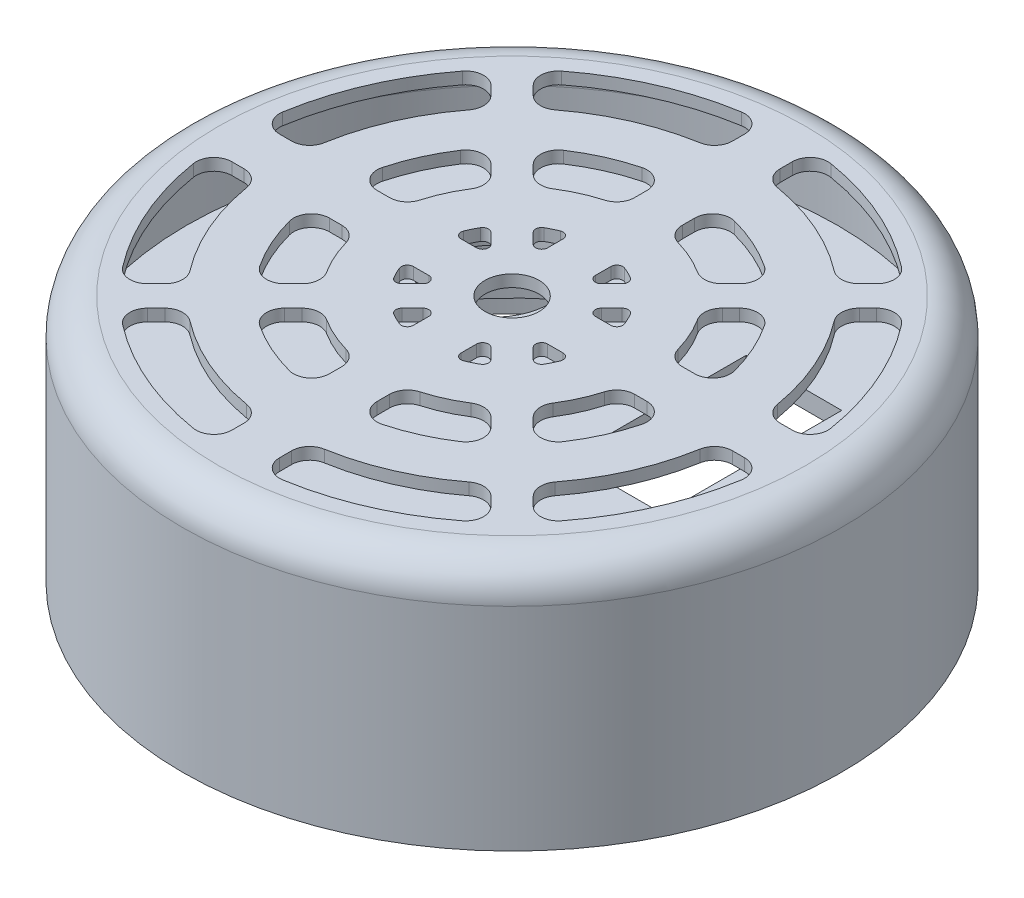
from build123d import *

# Parameters (mm, degrees)
SKETCH1_R                 = 55.2
BOSS_EXTRUDE1_DEPTH       = 3
SKETCH2_R                 = 55
CUT_EXTRUDE1_DEPTH        = 79.12221195
SKETCH4_R                 = 55.2
BOSS_EXTRUDE2_DEPTH       = 18.5
BOSS_EXTRUDE4_DEPTH       = 3
SKETCH6_R                 = 55.2
SKETCH6_R_2               = 9.5
SKETCH6_W                 = 16
SKETCH6_H                 = 30
BOSS_EXTRUDE3_DEPTH       = 3
SKETCH9_R                 = 55.2
SKETCH9_R_2               = 54.5
BOSS_EXTRUDE5_DEPTH       = 15
SKETCH10_R                = 55.2
SKETCH10_R_2              = 4.531369834
BOSS_EXTRUDE6_DEPTH       = 2
BOSS_EXTRUDE9_REACH       = 89.042
SKETCH15_R                = 3
F_3_0MM_DOWEL_HOLE2_D     = 3
F_3_0MM_DOWEL_HOLE2_DEPTH = 14
F_3_0MM_DOWEL_HOLE2_TIP   = 0.901290929
FILLET3_R                 = 6


with BuildPart() as part:
    # Sketch1 → Boss-Extrude1 (new body)
    with BuildSketch(Plane(origin=(0, 0, 0), x_dir=(1, 0, 0), z_dir=(0, 1, 0))):
        Circle(SKETCH1_R)
    extrude(amount=BOSS_EXTRUDE1_DEPTH)

    # Sketch2 → Cut-Extrude1 (cut, through all)
    with BuildSketch(Plane(origin=(0, 3, 0), x_dir=(1, 0, 0), z_dir=(0, 1, 0))):
        Circle(SKETCH2_R)
    extrude(amount=-CUT_EXTRUDE1_DEPTH, mode=Mode.SUBTRACT)

    # Sketch4 → Boss-Extrude2 (add)
    with BuildSketch(Plane(origin=(0, 3, 0), x_dir=(1, 0, 0), z_dir=(0, 1, 0))):
        Circle(SKETCH4_R)
        with BuildLine():
            Line((-45.2, -5), (-45.2, 5))
            Line((-45.2, 5), (-53.768020235, 5))
            ThreePointArc((-53.768020235, 5), (54, 0), (-53.768020235, -5))
            Line((-53.768020235, -5), (-45.2, -5))
        make_face(mode=Mode.SUBTRACT)
    extrude(amount=BOSS_EXTRUDE2_DEPTH)

    # Sketch8 → Boss-Extrude4 (add)
    with BuildSketch(Plane.XZ.offset(-3)):
        with BuildLine():
            Line((-45.2, 5), (-54.772255751, 5))
            ThreePointArc((-54.772255751, 5), (-55, 0), (-54.772255751, -5))
            Line((-54.772255751, -5), (-45.2, -5))
            Line((-45.2, -5), (-45.2, 5))
        make_face()
    extrude(amount=BOSS_EXTRUDE4_DEPTH)

    # Sketch6 → Boss-Extrude3 (add)
    with BuildSketch(Plane(origin=(0, 21.5, 0), x_dir=(1, 0, 0), z_dir=(0, 1, 0))):
        Circle(SKETCH6_R)
        with Locations((-22.20107336, 19.059873591)):
            Circle(SKETCH6_R_2, mode=Mode.SUBTRACT)
        with Locations((19.213108786, 13)):
            Rectangle(SKETCH6_W, SKETCH6_H, mode=Mode.SUBTRACT)
    extrude(amount=BOSS_EXTRUDE3_DEPTH)

    # Sketch9 → Boss-Extrude5 (add)
    with BuildSketch(Plane(origin=(0, 24.5, 0), x_dir=(1, 0, 0), z_dir=(0, 1, 0))):
        Circle(SKETCH9_R)
        Circle(SKETCH9_R_2, mode=Mode.SUBTRACT)
    extrude(amount=BOSS_EXTRUDE5_DEPTH)

    # Sketch10 → Boss-Extrude6 (add)
    with BuildSketch(Plane(origin=(0, 39.5, 0), x_dir=(1, 0, 0), z_dir=(0, 1, 0))):
        Circle(SKETCH10_R)
        Circle(SKETCH10_R_2, mode=Mode.SUBTRACT)
        with BuildLine():
            Line((-4, 40.905378619), (-4, 42.933087473))
            ThreePointArc((-4, 42.933087473), (-5.056842243, 45.218724787), (-7.482758621, 45.893990058))
            ThreePointArc((-7.482758621, 45.893990058), (-18.54054336, 42.643853624), (-28.459288433, 36.77388886))
            ThreePointArc((-28.459288433, 36.77388886), (-29.617180258, 34.591416734), (-28.744525652, 32.280059558))
            Line((-28.744525652, 32.280059558), (-27.318312192, 30.853846097))
            ThreePointArc((-27.318312192, 30.853846097), (-25.396226878, 29.981789518), (-23.375522558, 30.591419469))
            ThreePointArc((-23.375522558, 30.591419469), (-15.38108872, 35.294080379), (-6.493975904, 37.948363298))
            ThreePointArc((-6.493975904, 37.948363298), (-4.706741152, 38.971221476), (-4, 40.905378619))
        make_face(mode=Mode.SUBTRACT)
        with BuildLine():
            Line((-4, 24.52039967), (-4, 26.594172294))
            ThreePointArc((-4, 26.594172294), (-5.168458176, 28.970188823), (-7.763636364, 29.495354726))
            ThreePointArc((-7.763636364, 29.495354726), (-12.456434236, 27.840388756), (-16.817668487, 25.444371218))
            ThreePointArc((-16.817668487, 25.444371218), (-18.148280046, 23.243173066), (-17.28479193, 20.820325836))
            Line((-17.28479193, 20.820325836), (-15.839049909, 19.374583815))
            ThreePointArc((-15.839049909, 19.374583815), (-14.043179698, 18.513609369), (-12.103879028, 18.966974257))
            ThreePointArc((-12.103879028, 18.966974257), (-9.237058448, 20.516499488), (-6.176470588, 21.635646768))
            ThreePointArc((-6.176470588, 21.635646768), (-4.60515259, 22.713549958), (-4, 24.52039967))
        make_face(mode=Mode.SUBTRACT)
        with BuildLine():
            Line((-4, 9.949747468), (-4, 12.539936204))
            ThreePointArc((-4, 12.539936204), (-4.438916392, 13.367695339), (-5.37037037, 13.468820367))
            ThreePointArc((-5.37037037, 13.468820367), (-6.323646825, 13.048428673), (-7.244275962, 12.560671391))
            ThreePointArc((-7.244275962, 12.560671391), (-7.736085814, 11.825170316), (-7.451777504, 10.98731141))
            Line((-7.451777504, 10.98731141), (-5.707106781, 9.242640687))
            ThreePointArc((-5.707106781, 9.242640687), (-4.617316568, 9.025867936), (-4, 9.949747468))
        make_face(mode=Mode.SUBTRACT)
        with BuildLine():
            Line((-12.539936204, 4), (-9.949747468, 4))
            ThreePointArc((-9.949747468, 4), (-9.025867936, 4.617316568), (-9.242640687, 5.707106781))
            Line((-9.242640687, 5.707106781), (-10.98731141, 7.451777504))
            ThreePointArc((-10.98731141, 7.451777504), (-11.825170316, 7.736085814), (-12.560671391, 7.244275962))
            ThreePointArc((-12.560671391, 7.244275962), (-13.048428673, 6.323646825), (-13.468820367, 5.37037037))
            ThreePointArc((-13.468820367, 5.37037037), (-13.367695339, 4.438916392), (-12.539936204, 4))
        make_face(mode=Mode.SUBTRACT)
        with BuildLine():
            Line((-26.594172294, 4), (-24.52039967, 4))
            ThreePointArc((-24.52039967, 4), (-22.713549958, 4.60515259), (-21.635646768, 6.176470588))
            ThreePointArc((-21.635646768, 6.176470588), (-20.516499488, 9.237058448), (-18.966974257, 12.103879028))
            ThreePointArc((-18.966974257, 12.103879028), (-18.513609369, 14.043179698), (-19.374583815, 15.839049909))
            Line((-19.374583815, 15.839049909), (-20.820325836, 17.28479193))
            ThreePointArc((-20.820325836, 17.28479193), (-23.243173066, 18.148280046), (-25.444371218, 16.817668487))
            ThreePointArc((-25.444371218, 16.817668487), (-27.840388756, 12.456434236), (-29.495354726, 7.763636364))
            ThreePointArc((-29.495354726, 7.763636364), (-28.970188823, 5.168458176), (-26.594172294, 4))
        make_face(mode=Mode.SUBTRACT)
        with BuildLine():
            Line((-42.933087473, 4), (-40.905378619, 4))
            ThreePointArc((-40.905378619, 4), (-38.971221476, 4.706741152), (-37.948363298, 6.493975904))
            ThreePointArc((-37.948363298, 6.493975904), (-35.294080379, 15.38108872), (-30.591419469, 23.375522558))
            ThreePointArc((-30.591419469, 23.375522558), (-29.981789518, 25.396226878), (-30.853846097, 27.318312192))
            Line((-30.853846097, 27.318312192), (-32.280059558, 28.744525652))
            ThreePointArc((-32.280059558, 28.744525652), (-34.591416734, 29.617180258), (-36.77388886, 28.459288433))
            ThreePointArc((-36.77388886, 28.459288433), (-42.643853624, 18.54054336), (-45.893990058, 7.482758621))
            ThreePointArc((-45.893990058, 7.482758621), (-45.218724787, 5.056842243), (-42.933087473, 4))
        make_face(mode=Mode.SUBTRACT)
        with BuildLine():
            Line((9.242640687, 5.707106781), (10.98731141, 7.451777504))
            ThreePointArc((10.98731141, 7.451777504), (11.825170316, 7.736085814), (12.560671391, 7.244275962))
            ThreePointArc((12.560671391, 7.244275962), (13.048428673, 6.323646825), (13.468820367, 5.37037037))
            ThreePointArc((13.468820367, 5.37037037), (13.367695339, 4.438916392), (12.539936204, 4))
            Line((12.539936204, 4), (9.949747468, 4))
            ThreePointArc((9.949747468, 4), (9.025867936, 4.617316568), (9.242640687, 5.707106781))
        make_face(mode=Mode.SUBTRACT)
        with BuildLine():
            Line((5.707106781, 9.242640687), (7.451777504, 10.98731141))
            ThreePointArc((7.451777504, 10.98731141), (7.736085814, 11.825170316), (7.244275962, 12.560671391))
            ThreePointArc((7.244275962, 12.560671391), (6.323646825, 13.048428673), (5.37037037, 13.468820367))
            ThreePointArc((5.37037037, 13.468820367), (4.438916392, 13.367695339), (4, 12.539936204))
            Line((4, 12.539936204), (4, 9.949747468))
            ThreePointArc((4, 9.949747468), (4.617316568, 9.025867936), (5.707106781, 9.242640687))
        make_face(mode=Mode.SUBTRACT)
        with BuildLine():
            Line((4, 24.52039967), (4, 26.594172294))
            ThreePointArc((4, 26.594172294), (5.168458176, 28.970188823), (7.763636364, 29.495354726))
            ThreePointArc((7.763636364, 29.495354726), (12.456434236, 27.840388756), (16.817668487, 25.444371218))
            ThreePointArc((16.817668487, 25.444371218), (18.148280046, 23.243173066), (17.28479193, 20.820325836))
            Line((17.28479193, 20.820325836), (15.839049909, 19.374583815))
            ThreePointArc((15.839049909, 19.374583815), (14.043179698, 18.513609369), (12.103879028, 18.966974257))
            ThreePointArc((12.103879028, 18.966974257), (9.237058448, 20.516499488), (6.176470588, 21.635646768))
            ThreePointArc((6.176470588, 21.635646768), (4.60515259, 22.713549958), (4, 24.52039967))
        make_face(mode=Mode.SUBTRACT)
        with BuildLine():
            Line((19.374583815, 15.839049909), (20.820325836, 17.28479193))
            ThreePointArc((20.820325836, 17.28479193), (23.243173066, 18.148280046), (25.444371218, 16.817668487))
            ThreePointArc((25.444371218, 16.817668487), (27.840388756, 12.456434236), (29.495354726, 7.763636364))
            ThreePointArc((29.495354726, 7.763636364), (28.970188823, 5.168458176), (26.594172294, 4))
            Line((26.594172294, 4), (24.52039967, 4))
            ThreePointArc((24.52039967, 4), (22.713549958, 4.60515259), (21.635646768, 6.176470588))
            ThreePointArc((21.635646768, 6.176470588), (20.516499488, 9.237058448), (18.966974257, 12.103879028))
            ThreePointArc((18.966974257, 12.103879028), (18.513609369, 14.043179698), (19.374583815, 15.839049909))
        make_face(mode=Mode.SUBTRACT)
        with BuildLine():
            Line((42.933087473, 4), (40.905378619, 4))
            ThreePointArc((40.905378619, 4), (38.971221476, 4.706741152), (37.948363298, 6.493975904))
            ThreePointArc((37.948363298, 6.493975904), (35.294080379, 15.38108872), (30.591419469, 23.375522558))
            ThreePointArc((30.591419469, 23.375522558), (29.981789518, 25.396226878), (30.853846097, 27.318312192))
            Line((30.853846097, 27.318312192), (32.280059558, 28.744525652))
            ThreePointArc((32.280059558, 28.744525652), (34.591416734, 29.617180258), (36.77388886, 28.459288433))
            ThreePointArc((36.77388886, 28.459288433), (42.643853624, 18.54054336), (45.893990058, 7.482758621))
            ThreePointArc((45.893990058, 7.482758621), (45.218724787, 5.056842243), (42.933087473, 4))
        make_face(mode=Mode.SUBTRACT)
        with BuildLine():
            Line((4, 40.905378619), (4, 42.933087473))
            ThreePointArc((4, 42.933087473), (5.056842243, 45.218724787), (7.482758621, 45.893990058))
            ThreePointArc((7.482758621, 45.893990058), (18.54054336, 42.643853624), (28.459288433, 36.77388886))
            ThreePointArc((28.459288433, 36.77388886), (29.617180258, 34.591416734), (28.744525652, 32.280059558))
            Line((28.744525652, 32.280059558), (27.318312192, 30.853846097))
            ThreePointArc((27.318312192, 30.853846097), (25.396226878, 29.981789518), (23.375522558, 30.591419469))
            ThreePointArc((23.375522558, 30.591419469), (15.38108872, 35.294080379), (6.493975904, 37.948363298))
            ThreePointArc((6.493975904, 37.948363298), (4.706741152, 38.971221476), (4, 40.905378619))
        make_face(mode=Mode.SUBTRACT)
        with BuildLine():
            Line((30.853846097, -27.318312192), (32.280059558, -28.744525652))
            ThreePointArc((32.280059558, -28.744525652), (34.591416734, -29.617180258), (36.77388886, -28.459288433))
            ThreePointArc((36.77388886, -28.459288433), (42.643853624, -18.54054336), (45.893990058, -7.482758621))
            ThreePointArc((45.893990058, -7.482758621), (45.218724787, -5.056842243), (42.933087473, -4))
            Line((42.933087473, -4), (40.905378619, -4))
            ThreePointArc((40.905378619, -4), (38.971221476, -4.706741152), (37.948363298, -6.493975904))
            ThreePointArc((37.948363298, -6.493975904), (35.294080379, -15.38108872), (30.591419469, -23.375522558))
            ThreePointArc((30.591419469, -23.375522558), (29.981789518, -25.396226878), (30.853846097, -27.318312192))
        make_face(mode=Mode.SUBTRACT)
        with BuildLine():
            Line((26.594172294, -4), (24.52039967, -4))
            ThreePointArc((24.52039967, -4), (22.713549958, -4.60515259), (21.635646768, -6.176470588))
            ThreePointArc((21.635646768, -6.176470588), (20.516499488, -9.237058448), (18.966974257, -12.103879028))
            ThreePointArc((18.966974257, -12.103879028), (18.513609369, -14.043179698), (19.374583815, -15.839049909))
            Line((19.374583815, -15.839049909), (20.820325836, -17.28479193))
            ThreePointArc((20.820325836, -17.28479193), (23.243173066, -18.148280046), (25.444371218, -16.817668487))
            ThreePointArc((25.444371218, -16.817668487), (27.840388756, -12.456434236), (29.495354726, -7.763636364))
            ThreePointArc((29.495354726, -7.763636364), (28.970188823, -5.168458176), (26.594172294, -4))
        make_face(mode=Mode.SUBTRACT)
        with BuildLine():
            Line((9.242640687, -5.707106781), (10.98731141, -7.451777504))
            ThreePointArc((10.98731141, -7.451777504), (11.825170316, -7.736085814), (12.560671391, -7.244275962))
            ThreePointArc((12.560671391, -7.244275962), (13.048428673, -6.323646825), (13.468820367, -5.37037037))
            ThreePointArc((13.468820367, -5.37037037), (13.367695339, -4.438916392), (12.539936204, -4))
            Line((12.539936204, -4), (9.949747468, -4))
            ThreePointArc((9.949747468, -4), (9.025867936, -4.617316568), (9.242640687, -5.707106781))
        make_face(mode=Mode.SUBTRACT)
        with BuildLine():
            Line((-9.242640687, -5.707106781), (-10.98731141, -7.451777504))
            ThreePointArc((-10.98731141, -7.451777504), (-11.825170316, -7.736085814), (-12.560671391, -7.244275962))
            ThreePointArc((-12.560671391, -7.244275962), (-13.048428673, -6.323646825), (-13.468820367, -5.37037037))
            ThreePointArc((-13.468820367, -5.37037037), (-13.367695339, -4.438916392), (-12.539936204, -4))
            Line((-12.539936204, -4), (-9.949747468, -4))
            ThreePointArc((-9.949747468, -4), (-9.025867936, -4.617316568), (-9.242640687, -5.707106781))
        make_face(mode=Mode.SUBTRACT)
        with BuildLine():
            Line((-5.707106781, -9.242640687), (-7.451777504, -10.98731141))
            ThreePointArc((-7.451777504, -10.98731141), (-7.736085814, -11.825170316), (-7.244275962, -12.560671391))
            ThreePointArc((-7.244275962, -12.560671391), (-6.323646825, -13.048428673), (-5.37037037, -13.468820367))
            ThreePointArc((-5.37037037, -13.468820367), (-4.438916392, -13.367695339), (-4, -12.539936204))
            Line((-4, -12.539936204), (-4, -9.949747468))
            ThreePointArc((-4, -9.949747468), (-4.617316568, -9.025867936), (-5.707106781, -9.242640687))
        make_face(mode=Mode.SUBTRACT)
        with BuildLine():
            Line((4, -9.949747468), (4, -12.539936204))
            ThreePointArc((4, -12.539936204), (4.438916392, -13.367695339), (5.37037037, -13.468820367))
            ThreePointArc((5.37037037, -13.468820367), (6.323646825, -13.048428673), (7.244275962, -12.560671391))
            ThreePointArc((7.244275962, -12.560671391), (7.736085814, -11.825170316), (7.451777504, -10.98731141))
            Line((7.451777504, -10.98731141), (5.707106781, -9.242640687))
            ThreePointArc((5.707106781, -9.242640687), (4.617316568, -9.025867936), (4, -9.949747468))
        make_face(mode=Mode.SUBTRACT)
        with BuildLine():
            Line((4, -24.52039967), (4, -26.594172294))
            ThreePointArc((4, -26.594172294), (5.168458176, -28.970188823), (7.763636364, -29.495354726))
            ThreePointArc((7.763636364, -29.495354726), (12.456434236, -27.840388756), (16.817668487, -25.444371218))
            ThreePointArc((16.817668487, -25.444371218), (18.148280046, -23.243173066), (17.28479193, -20.820325836))
            Line((17.28479193, -20.820325836), (15.839049909, -19.374583815))
            ThreePointArc((15.839049909, -19.374583815), (14.043179698, -18.513609369), (12.103879028, -18.966974257))
            ThreePointArc((12.103879028, -18.966974257), (9.237058448, -20.516499488), (6.176470588, -21.635646768))
            ThreePointArc((6.176470588, -21.635646768), (4.60515259, -22.713549958), (4, -24.52039967))
        make_face(mode=Mode.SUBTRACT)
        with BuildLine():
            Line((4, -40.905378619), (4, -42.933087473))
            ThreePointArc((4, -42.933087473), (5.056842243, -45.218724787), (7.482758621, -45.893990058))
            ThreePointArc((7.482758621, -45.893990058), (18.54054336, -42.643853624), (28.459288433, -36.77388886))
            ThreePointArc((28.459288433, -36.77388886), (29.617180258, -34.591416734), (28.744525652, -32.280059558))
            Line((28.744525652, -32.280059558), (27.318312192, -30.853846097))
            ThreePointArc((27.318312192, -30.853846097), (25.396226878, -29.981789518), (23.375522558, -30.591419469))
            ThreePointArc((23.375522558, -30.591419469), (15.38108872, -35.294080379), (6.493975904, -37.948363298))
            ThreePointArc((6.493975904, -37.948363298), (4.706741152, -38.971221476), (4, -40.905378619))
        make_face(mode=Mode.SUBTRACT)
        with BuildLine():
            Line((-4, -24.52039967), (-4, -26.594172294))
            ThreePointArc((-4, -26.594172294), (-5.168458176, -28.970188823), (-7.763636364, -29.495354726))
            ThreePointArc((-7.763636364, -29.495354726), (-12.456434236, -27.840388756), (-16.817668487, -25.444371218))
            ThreePointArc((-16.817668487, -25.444371218), (-18.148280046, -23.243173066), (-17.28479193, -20.820325836))
            Line((-17.28479193, -20.820325836), (-15.839049909, -19.374583815))
            ThreePointArc((-15.839049909, -19.374583815), (-14.043179698, -18.513609369), (-12.103879028, -18.966974257))
            ThreePointArc((-12.103879028, -18.966974257), (-9.237058448, -20.516499488), (-6.176470588, -21.635646768))
            ThreePointArc((-6.176470588, -21.635646768), (-4.60515259, -22.713549958), (-4, -24.52039967))
        make_face(mode=Mode.SUBTRACT)
        with BuildLine():
            Line((-19.374583815, -15.839049909), (-20.820325836, -17.28479193))
            ThreePointArc((-20.820325836, -17.28479193), (-23.243173066, -18.148280046), (-25.444371218, -16.817668487))
            ThreePointArc((-25.444371218, -16.817668487), (-27.840388756, -12.456434236), (-29.495354726, -7.763636364))
            ThreePointArc((-29.495354726, -7.763636364), (-28.970188823, -5.168458176), (-26.594172294, -4))
            Line((-26.594172294, -4), (-24.52039967, -4))
            ThreePointArc((-24.52039967, -4), (-22.713549958, -4.60515259), (-21.635646768, -6.176470588))
            ThreePointArc((-21.635646768, -6.176470588), (-20.516499488, -9.237058448), (-18.966974257, -12.103879028))
            ThreePointArc((-18.966974257, -12.103879028), (-18.513609369, -14.043179698), (-19.374583815, -15.839049909))
        make_face(mode=Mode.SUBTRACT)
        with BuildLine():
            Line((-42.933087473, -4), (-40.905378619, -4))
            ThreePointArc((-40.905378619, -4), (-38.971221476, -4.706741152), (-37.948363298, -6.493975904))
            ThreePointArc((-37.948363298, -6.493975904), (-35.294080379, -15.38108872), (-30.591419469, -23.375522558))
            ThreePointArc((-30.591419469, -23.375522558), (-29.981789518, -25.396226878), (-30.853846097, -27.318312192))
            Line((-30.853846097, -27.318312192), (-32.280059558, -28.744525652))
            ThreePointArc((-32.280059558, -28.744525652), (-34.591416734, -29.617180258), (-36.77388886, -28.459288433))
            ThreePointArc((-36.77388886, -28.459288433), (-42.643853624, -18.54054336), (-45.893990058, -7.482758621))
            ThreePointArc((-45.893990058, -7.482758621), (-45.218724787, -5.056842243), (-42.933087473, -4))
        make_face(mode=Mode.SUBTRACT)
        with BuildLine():
            Line((-4, -40.905378619), (-4, -42.933087473))
            ThreePointArc((-4, -42.933087473), (-5.056842243, -45.218724787), (-7.482758621, -45.893990058))
            ThreePointArc((-7.482758621, -45.893990058), (-18.54054336, -42.643853624), (-28.459288433, -36.77388886))
            ThreePointArc((-28.459288433, -36.77388886), (-29.617180258, -34.591416734), (-28.744525652, -32.280059558))
            Line((-28.744525652, -32.280059558), (-27.318312192, -30.853846097))
            ThreePointArc((-27.318312192, -30.853846097), (-25.396226878, -29.981789518), (-23.375522558, -30.591419469))
            ThreePointArc((-23.375522558, -30.591419469), (-15.38108872, -35.294080379), (-6.493975904, -37.948363298))
            ThreePointArc((-6.493975904, -37.948363298), (-4.706741152, -38.971221476), (-4, -40.905378619))
        make_face(mode=Mode.SUBTRACT)
    extrude(amount=BOSS_EXTRUDE6_DEPTH)

    # Sketch15 → Boss-Extrude9 (add, up to next)
    with BuildSketch(Plane.XZ.offset(-3), mode=Mode.PRIVATE) as boss_extrude9_sk1:
        with Locations((0, 42)):
            Circle(SKETCH15_R)
    boss_extrude9_tool1 = extrude(boss_extrude9_sk1.sketch, amount=-BOSS_EXTRUDE9_REACH, mode=Mode.PRIVATE) - part.part
    # Sketch15 → Boss-Extrude9 (add, up to next)
    with BuildSketch(Plane.XZ.offset(-3), mode=Mode.PRIVATE) as boss_extrude9_sk2:
        with Locations((0, -37)):
            Circle(SKETCH15_R)
    boss_extrude9_tool2 = extrude(boss_extrude9_sk2.sketch, amount=-BOSS_EXTRUDE9_REACH, mode=Mode.PRIVATE) - part.part
    add(boss_extrude9_tool1.solids().sort_by_distance((0, 3, 42))[0])
    add(boss_extrude9_tool2.solids().sort_by_distance((0, 3, -37))[0])

    # Ø3.0mm Dowel Hole2
    with Locations(Plane(origin=(0, 3, 42), x_dir=(0, 0, -1), z_dir=(0, -1, 0))):
        with Locations((0, 0), (79, 0)):
            Hole(F_3_0MM_DOWEL_HOLE2_D / 2, depth=F_3_0MM_DOWEL_HOLE2_DEPTH)
            with Locations((0, 0, -(F_3_0MM_DOWEL_HOLE2_DEPTH + F_3_0MM_DOWEL_HOLE2_TIP / 2))):  # 118° drill point
                Cone(0, F_3_0MM_DOWEL_HOLE2_D / 2, F_3_0MM_DOWEL_HOLE2_TIP, mode=Mode.SUBTRACT)

    # Fillet3
    fillet3_edges = [part.edges().sort_by_distance(p)[0] for p in [
        (-54.5, 39.5, 0),
        (-55.2, 41.5, 0),
    ]]
    fillet(fillet3_edges, radius=FILLET3_R)


solid = part.part
